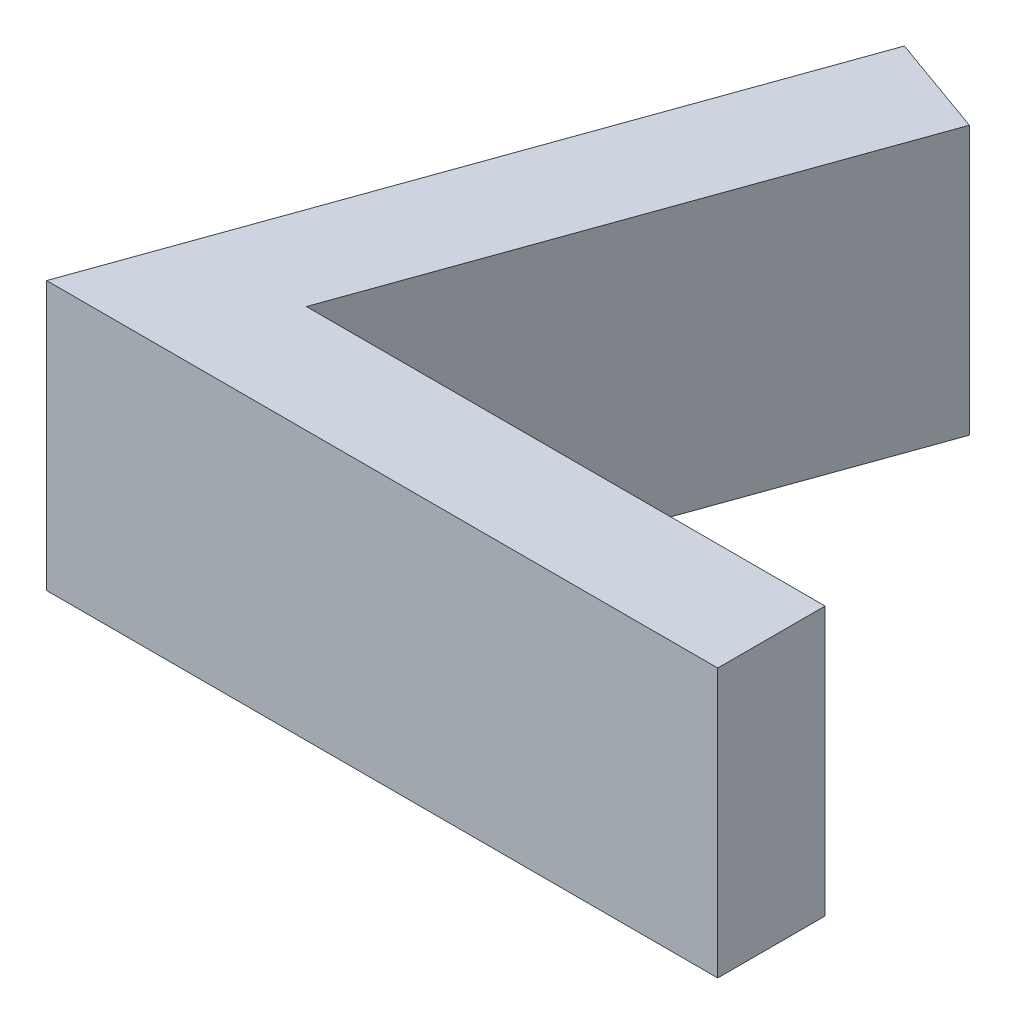
from build123d import *

# Parameters (mm, degrees)
BOSS_EXTRUDE1_DEPTH = 20


with BuildPart() as part:
    # Sketch1 → Boss-Extrude1 (new body)
    with BuildSketch(Plane(origin=(0, 0, 0), x_dir=(1, 0, 0), z_dir=(0, 1, 0))):
        Polygon((0, 0), (12.679677005, 0), (12.679677005, 8), (-25.968283702, 8), (-12.96956782, 44.396404386), (-20.503503111, 47.087095567), (-37.320322995, 0), align=None)
    extrude(amount=BOSS_EXTRUDE1_DEPTH)


solid = part.part
